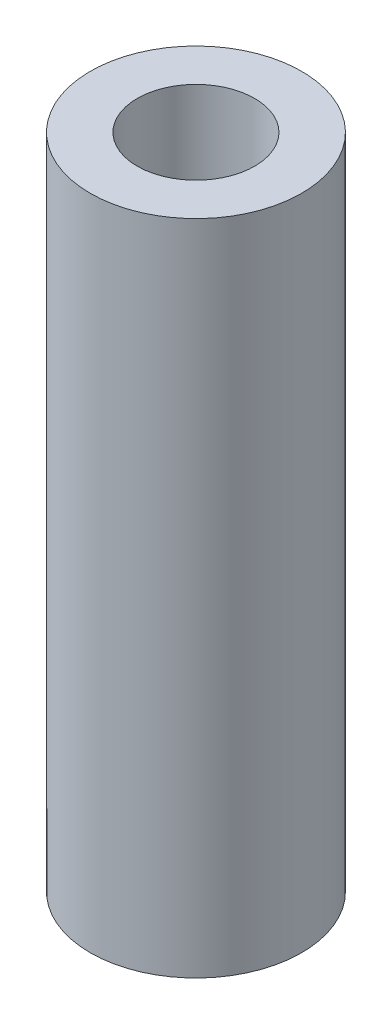
from build123d import *

# Parameters (mm, degrees)
SKETCH2_R           = 57.15
SKETCH2_R_2         = 31.75
BOSS_EXTRUDE1_DEPTH = 355.6


with BuildPart() as part:
    # Sketch2 → Boss-Extrude1 (new body)
    with BuildSketch(Plane(origin=(0, 0, 0), x_dir=(1, 0, 0), z_dir=(0, 1, 0))):
        Circle(SKETCH2_R)
        Circle(SKETCH2_R_2, mode=Mode.SUBTRACT)
    extrude(amount=BOSS_EXTRUDE1_DEPTH)


solid = part.part
